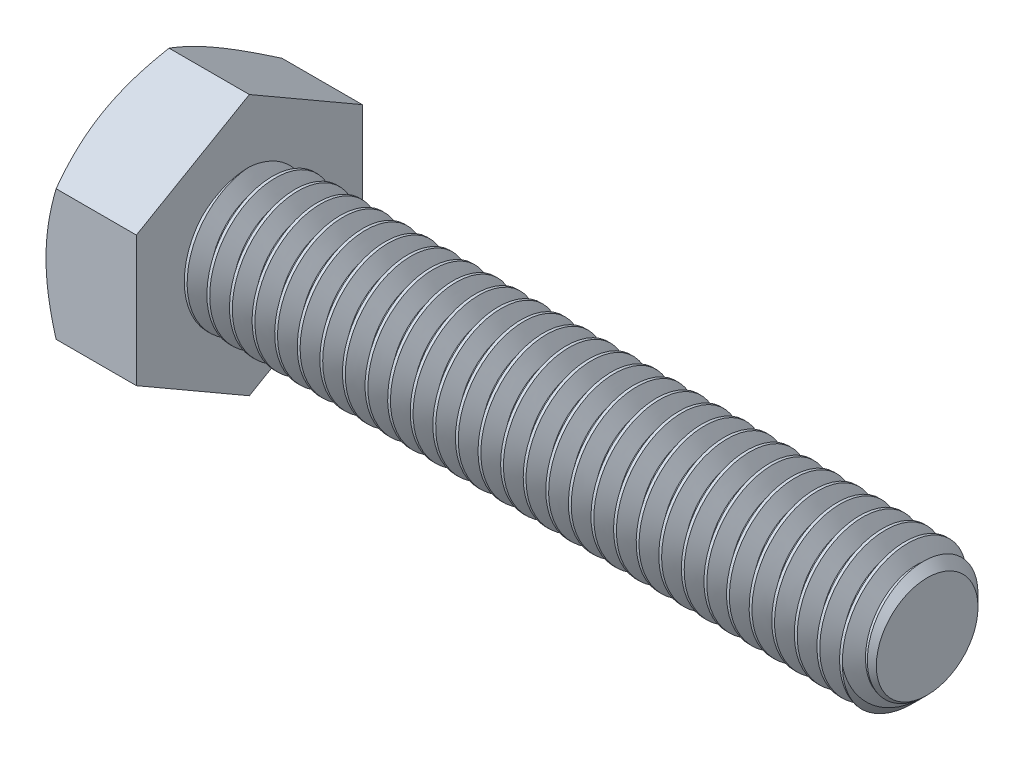
from build123d import *

# Parameters (mm, degrees)
SKETCH2_R           = 3
BOSS_EXTRUDE1_DEPTH = 30
CHAMFER1_SIZE       = 0.75
CUT_SWEEP1_PITCH    = 1
BOSS_EXTRUDE2_DEPTH = 4
SKETCH6_OUTSIDE_W   = 143.634
SKETCH6_OUTSIDE_H   = 145.182
SKETCH6_OUTSIDE_R   = 5
CUT_EXTRUDE1_DEPTH  = 35.84728601
CUT_EXTRUDE1_DRAFT  = -60


with BuildPart() as part:
    # Sketch2 → Boss-Extrude1 (new body)
    with BuildSketch(Plane(origin=(17, 0, 0), x_dir=(0, 0, -1), z_dir=(1, 0, 0))):
        Circle(SKETCH2_R)
    extrude(amount=-BOSS_EXTRUDE1_DEPTH)

    # Chamfer1
    chamfer1_edges = [part.edges().sort_by_distance(p)[0] for p in [
        (17, 0, 3),
    ]]
    chamfer(chamfer1_edges, length=CHAMFER1_SIZE)

    # Cut-Sweep1: arcs per turn and ends read off the stored shape
    # Cut-Sweep1: the profile of Sketch5 profile screwed along a right-hand helix through 31 turns, 8 arcs to a turn; built about Z, then put on its axis
    cut_sweep1_z = Axis((0, 0, 0), (0, 0, 1))
    cut_sweep1_corners = [(3.0003, 0, 0.000173205), (2.350480947, 0, -0.375), (2.350480947, 0, -0.5), (3.0003, 0, -0.875173205)]
    with BuildLine(mode=Mode.PRIVATE) as cut_sweep1_profile:
        Line(cut_sweep1_corners[0], cut_sweep1_corners[1])
        Line(cut_sweep1_corners[1], cut_sweep1_corners[2])
        Line(cut_sweep1_corners[2], cut_sweep1_corners[3])
        Line(cut_sweep1_corners[3], cut_sweep1_corners[0])
    cut_sweep1_cap = Face(cut_sweep1_profile.wire())
    cut_sweep1_turn_angles = [0, 22.5, 45, 67.5, 90, 112.5, 135, 157.5, 180, 202.5, 225, 247.5, 270, 292.5, 315, 337.5, 360]
    cut_sweep1_turn_weights = [1, 0.9238795325112867, 1, 0.9238795325112867, 1, 0.9238795325112867, 1, 0.9238795325112867, 1, 0.9238795325112867, 1, 0.9238795325112867, 1, 0.9238795325112867, 1, 0.9238795325112867, 1]
    cut_sweep1_turn_rails = [Edge.make_bspline([Vector(p[0], p[1], 0).rotate(cut_sweep1_z, cut_sweep1_turn_angles[k]) / cut_sweep1_turn_weights[k] + Vector(0, 0, p[2] + CUT_SWEEP1_PITCH * cut_sweep1_turn_angles[k] / 360) for k in range(17)], [0, 0, 0, 1, 1, 2, 2, 3, 3, 4, 4, 5, 5, 6, 6, 7, 7, 8, 8, 8], 2, cut_sweep1_turn_weights) for p in cut_sweep1_corners]
    cut_sweep1_turn_sides = [Face.make_surface_from_curves(cut_sweep1_turn_rails[p[0]], cut_sweep1_turn_rails[p[1]]) for p in [(0, 1), (1, 2), (2, 3), (3, 0)]]
    cut_sweep1 = Plane(origin=(17, 0, 0), x_dir=(0, 1, 0), z_dir=(-1, 0, 0)) * Solid(Shell([*[p.moved(Location((0, 0, CUT_SWEEP1_PITCH * i))) for i in range(31) for p in cut_sweep1_turn_sides], cut_sweep1_cap, cut_sweep1_cap.rotate(cut_sweep1_z, 11160).moved(Location((0, 0, CUT_SWEEP1_PITCH * 11160 / 360)))]))
    add(cut_sweep1, mode=Mode.SUBTRACT)

    # Sketch3 → Boss-Extrude2 (add)
    with BuildSketch(Plane.ZY.offset(13)):
        Polygon((-5, -2.886751346), (0, -5.773502692), (5, -2.886751346), (5, 2.886751346), (0, 5.773502692), (-5, 2.886751346), align=None)
    extrude(amount=BOSS_EXTRUDE2_DEPTH)


with BuildPart() as cut_extrude1_tool:
    # Sketch6 outside → Cut-Extrude1 (with draft: the straight prism first)
    with BuildSketch(Plane.ZY.offset(17)):
        Rectangle(SKETCH6_OUTSIDE_W, SKETCH6_OUTSIDE_H)
        Circle(SKETCH6_OUTSIDE_R, mode=Mode.SUBTRACT)
    extrude(amount=-CUT_EXTRUDE1_DEPTH)
    # Cut-Extrude1: the draft: its side faces are tilted about the plane it starts from
    cut_extrude1_sides = [cut_extrude1_tool.faces().sort_by_distance(p)[0] for p in [
        (0.923643005, -72.591, 0),
        (0.923643005, 0, 71.817),
        (0.923643005, 72.591, 0),
        (0.923643005, 0, -71.817),
        (0.923643005, 0, -5),
    ]]
    draft(cut_extrude1_sides, Plane.ZY.offset(17), CUT_EXTRUDE1_DRAFT)


with BuildPart() as part_1:
    add(part.part)

    # Cut-Extrude1: cut by cut_extrude1_tool
    add(cut_extrude1_tool.part, mode=Mode.SUBTRACT)


solid = part_1.part
